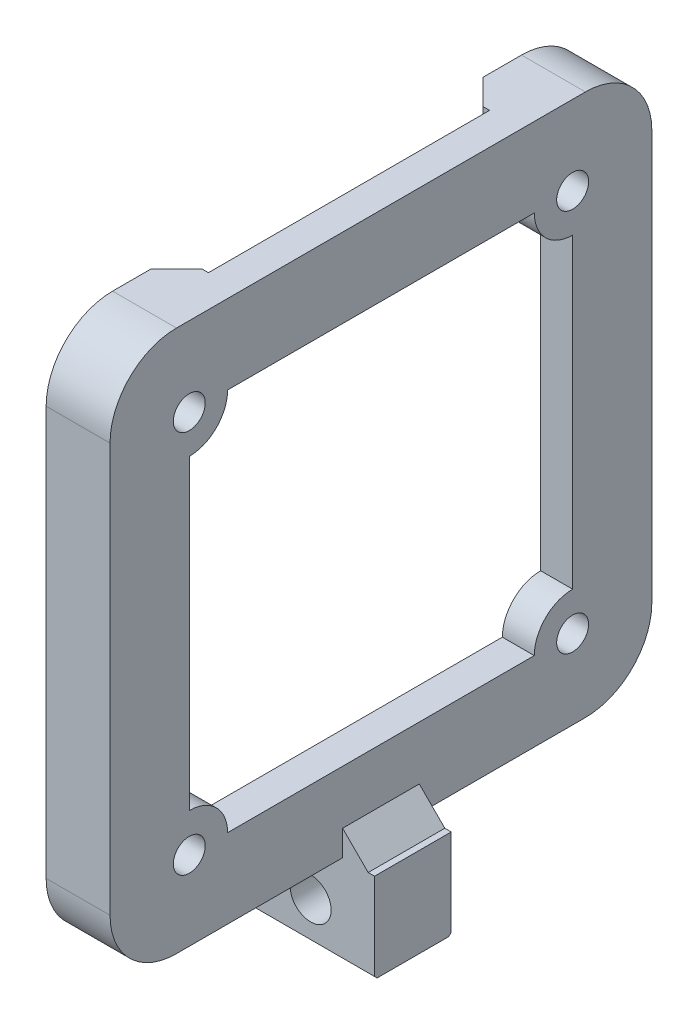
from build123d import *

# Parameters (mm, degrees)
SKETCH1_R           = 1.25
BOSS_EXTRUDE1_DEPTH = 2.5
BOSS_EXTRUDE2_DEPTH = 2.5
BOSS_EXTRUDE4_START = 2.5
BOSS_EXTRUDE4_DEPTH = 2.5
SKETCH5_W           = 10
SKETCH5_H           = 6
BOSS_EXTRUDE6_DEPTH = 8
CHAMFER1_SIZE       = 2
SKETCH6_R           = 1.6
CUT_EXTRUDE1_DEPTH  = 8
CHAMFER2_SIZE       = 1
CHAMFER3_SIZE       = 1.2
SKETCH7_W           = 2.5
SKETCH7_H           = 22
CUT_EXTRUDE2_DEPTH  = 55.835083878
CHAMFER4_SIZE       = 2


with BuildPart() as part:
    # Sketch1 → Boss-Extrude1 (new body)
    with BuildSketch(Plane(origin=(0, 0, 0), x_dir=(0, 0, -1), z_dir=(1, 0, 0))):
        with BuildLine():
            ThreePointArc((-20.08490506, 22.793126127), (-22.206225403, 21.914446471), (-23.08490506, 19.793126127))
            Line((-23.08490506, 19.793126127), (-23.08490506, -12.206873873))
            ThreePointArc((-23.08490506, -12.206873873), (-22.206225403, -14.328194216), (-20.08490506, -15.206873873))
            Line((-20.08490506, -15.206873873), (11.91509494, -15.206873873))
            ThreePointArc((11.91509494, -15.206873873), (14.036415284, -14.328194216), (14.91509494, -12.206873873))
            Line((14.91509494, -12.206873873), (14.91509494, 19.793126127))
            ThreePointArc((14.91509494, 19.793126127), (14.036415284, 21.914446471), (11.91509494, 22.793126127))
            Line((11.91509494, 22.793126127), (-20.08490506, 22.793126127))
        make_face()
        with Locations((-19.08490506, -11.206873873)):
            Circle(SKETCH1_R, mode=Mode.SUBTRACT)
        with Locations((10.91509494, -11.206873873)):
            Circle(SKETCH1_R, mode=Mode.SUBTRACT)
        with BuildLine():
            ThreePointArc((-19.08490506, 17.543126127), (-19.968788536, 19.677009604), (-17.83490506, 18.793126127))
            ThreePointArc((-17.83490506, 18.793126127), (-18.201021583, 17.909242651), (-19.08490506, 17.543126127))
        make_face(mode=Mode.SUBTRACT)
        with BuildLine():
            Line((-19.08490506, -8.206873873), (-19.08490506, 15.793126127))
            ThreePointArc((-19.08490506, 15.793126127), (-16.963584716, 16.671805784), (-16.08490506, 18.793126127))
            Line((-16.08490506, 18.793126127), (7.91509494, 18.793126127))
            ThreePointArc((7.91509494, 18.793126127), (8.793774597, 16.671805784), (10.91509494, 15.793126127))
            Line((10.91509494, 15.793126127), (10.91509494, -8.206873873))
            ThreePointArc((10.91509494, -8.206873873), (8.793774597, -9.085553529), (7.91509494, -11.206873873))
            Line((7.91509494, -11.206873873), (-16.08490506, -11.206873873))
            ThreePointArc((-16.08490506, -11.206873873), (-16.963584716, -9.085553529), (-19.08490506, -8.206873873))
        make_face(mode=Mode.SUBTRACT)
        with Locations((10.91509494, 18.793126127)):
            Circle(SKETCH1_R, mode=Mode.SUBTRACT)
    extrude(amount=BOSS_EXTRUDE1_DEPTH)

    # Sketch2 → Boss-Extrude2 (add)
    with BuildSketch(Plane.ZY):
        with BuildLine():
            Line((-17.11509494, 19.793126127), (-17.11509494, -12.206873873))
            ThreePointArc((-17.11509494, -12.206873873), (-15.592050202, -15.883829135), (-11.91509494, -17.406873873))
            Line((-11.91509494, -17.406873873), (20.08490506, -17.406873873))
            ThreePointArc((20.08490506, -17.406873873), (23.761860322, -15.883829135), (25.28490506, -12.206873873))
            Line((25.28490506, -12.206873873), (25.28490506, 19.793126127))
            ThreePointArc((25.28490506, 19.793126127), (23.761860322, 23.470081389), (20.08490506, 24.993126127))
            Line((20.08490506, 24.993126127), (-11.91509494, 24.993126127))
            ThreePointArc((-11.91509494, 24.993126127), (-15.592050202, 23.470081389), (-17.11509494, 19.793126127))
        make_face()
        with BuildLine():
            Line((-14.91509494, 19.793126127), (-14.91509494, -12.206873873))
            ThreePointArc((-14.91509494, -12.206873873), (-14.036415284, -14.328194216), (-11.91509494, -15.206873873))
            Line((-11.91509494, -15.206873873), (20.08490506, -15.206873873))
            ThreePointArc((20.08490506, -15.206873873), (22.206225403, -14.328194216), (23.08490506, -12.206873873))
            Line((23.08490506, -12.206873873), (23.08490506, 19.793126127))
            ThreePointArc((23.08490506, 19.793126127), (22.206225403, 21.914446471), (20.08490506, 22.793126127))
            Line((20.08490506, 22.793126127), (-11.91509494, 22.793126127))
            ThreePointArc((-11.91509494, 22.793126127), (-14.036415284, 21.914446471), (-14.91509494, 19.793126127))
        make_face(mode=Mode.SUBTRACT)
    extrude(amount=-BOSS_EXTRUDE2_DEPTH)

    # Sketch3 → Boss-Extrude4 (add)
    with BuildSketch(Plane.ZY.offset(BOSS_EXTRUDE4_START)):
        with BuildLine():
            Line((-17.11509494, 19.793126127), (-17.11509494, -12.206873873))
            ThreePointArc((-17.11509494, -12.206873873), (-15.592050202, -15.883829135), (-11.91509494, -17.406873873))
            Line((-11.91509494, -17.406873873), (20.08490506, -17.406873873))
            ThreePointArc((20.08490506, -17.406873873), (23.761860322, -15.883829135), (25.28490506, -12.206873873))
            Line((25.28490506, -12.206873873), (25.28490506, 19.793126127))
            ThreePointArc((25.28490506, 19.793126127), (23.761860322, 23.470081389), (20.08490506, 24.993126127))
            Line((20.08490506, 24.993126127), (-11.91509494, 24.993126127))
            ThreePointArc((-11.91509494, 24.993126127), (-15.592050202, 23.470081389), (-17.11509494, 19.793126127))
        make_face()
        with BuildLine():
            Line((-15.11509494, 19.793126127), (-15.11509494, -12.206873873))
            ThreePointArc((-15.11509494, -12.206873873), (-14.17783664, -14.469615573), (-11.91509494, -15.406873873))
            Line((-11.91509494, -15.406873873), (20.08490506, -15.406873873))
            ThreePointArc((20.08490506, -15.406873873), (22.34764676, -14.469615573), (23.28490506, -12.206873873))
            Line((23.28490506, -12.206873873), (23.28490506, 19.793126127))
            ThreePointArc((23.28490506, 19.793126127), (22.34764676, 22.055867827), (20.08490506, 22.993126127))
            Line((20.08490506, 22.993126127), (-11.91509494, 22.993126127))
            ThreePointArc((-11.91509494, 22.993126127), (-14.17783664, 22.055867827), (-15.11509494, 19.793126127))
        make_face(mode=Mode.SUBTRACT)
    extrude(amount=-BOSS_EXTRUDE4_DEPTH)

    # Sketch5 → Boss-Extrude6 (add)
    with BuildSketch(Plane.XZ.offset(17.406873873)):
        with Locations((0, 4.08490506)):
            Rectangle(SKETCH5_W, SKETCH5_H)
    extrude(amount=BOSS_EXTRUDE6_DEPTH)

    # Chamfer1
    chamfer1_edges = [part.edges().sort_by_distance(p)[0] for p in [
        (-2.5, -17.406873873, 4.08490506),
        (2.5, -17.406873873, 4.08490506),
    ]]
    chamfer(chamfer1_edges, length=CHAMFER1_SIZE - 0.0001)  # a hair under: the kernel refuses the full size

    # Sketch6 → Cut-Extrude1 (cut)
    with BuildSketch(Plane(origin=(0, 0, 1.08490506), x_dir=(-1, 0, 0), z_dir=(0, 0, -1))):
        with Locations((0, -21.406873873)):
            Circle(SKETCH6_R)
    extrude(amount=-CUT_EXTRUDE1_DEPTH, mode=Mode.SUBTRACT)

    # Chamfer2
    chamfer2_edges = [part.edges().sort_by_distance(p)[0] for p in [
        (-5, -25.406873873, 4.08490506),
        (5, -25.406873873, 4.08490506),
    ]]
    chamfer(chamfer2_edges, length=CHAMFER2_SIZE)

    # Chamfer3
    chamfer3_edges = [part.edges().sort_by_distance(p)[0] for p in [
        (0, -25.406873873, 1.08490506),
        (0, -25.406873873, 7.08490506),
    ]]
    chamfer(chamfer3_edges, length=CHAMFER3_SIZE)

    # Sketch7 → Cut-Extrude2 (cut, through all)
    with BuildSketch(Plane.XZ.offset(-22.993126127)):
        with Locations((-1.25, 4.08490506)):
            Rectangle(SKETCH7_W, SKETCH7_H)
    extrude(amount=-CUT_EXTRUDE2_DEPTH, mode=Mode.SUBTRACT)

    # Chamfer4
    chamfer4_edges = [part.edges().sort_by_distance(p)[0] for p in [
        (-2.5, 23.993126127, -6.91509494),
        (-2.5, 23.993126127, 15.08490506),
    ]]
    chamfer(chamfer4_edges, length=CHAMFER4_SIZE)


solid = part.part
